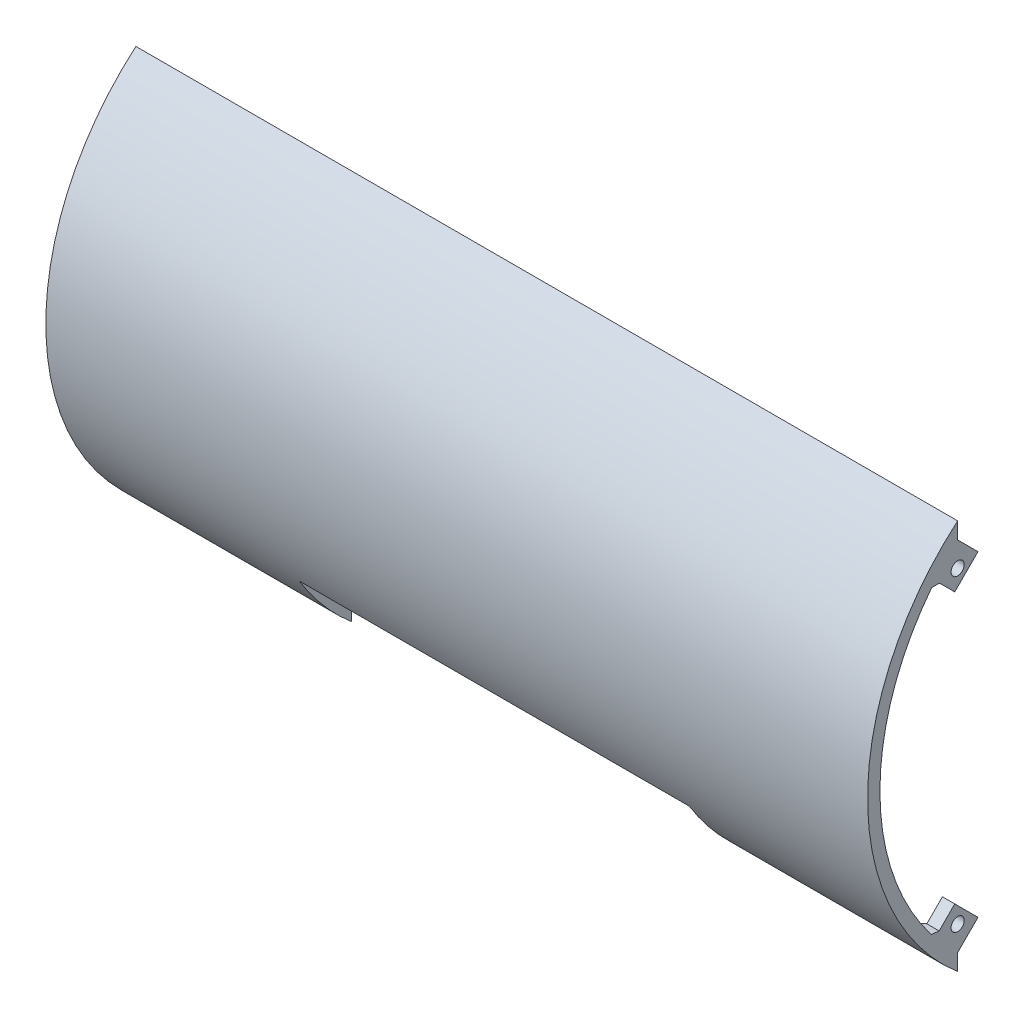
from build123d import *

# Parameters (mm, degrees)
EXTRUDE_2_DEPTH          = 200
EXTRUDE_START            = -3
SKETCH_3_R               = 1.6
EXTRUDE_3_DEPTH          = 3
MIRROR_START             = -3
MIRROR_3_COPY_1_SKETCH_R = 1.6
MIRROR_3_COPY_1_DEPTH    = 3
CHAMFER_2_SIZE           = 1.5
CHAMFER_2_SIZE_2         = 1.370885416
CUT_EXTRUDE_1_REACH      = 208.729
CUT_EXTRUDE_1_END_RADIUS = 62.42
SKETCH_4_W               = 95
SKETCH_4_H               = 15


with BuildPart() as part:
    # 草图2 → 凸台-拉伸2 (new body)
    with BuildSketch(Plane(origin=(0, 0, 0), x_dir=(0, 0, -1), z_dir=(1, 0, 0))):
        with BuildLine():
            Line((-40.496992481, 43.482525226), (-40.496992481, 47.5))
            ThreePointArc((-40.496992481, 47.5), (-62.42, 0), (-40.496992481, -47.5))
            Line((-40.496992481, -47.5), (-40.496992481, -43.482525226))
            ThreePointArc((-40.496992481, -43.482525226), (-59.42, 0), (-40.496992481, 43.482525226))
        make_face()
    extrude(amount=EXTRUDE_2_DEPTH)

    # 草图3 → 凸台-拉伸3 (add)
    with BuildSketch(Plane(origin=(200, 0, 0), x_dir=(0, 0, -1), z_dir=(1, 0, 0)).offset(EXTRUDE_START)):
        with BuildLine():
            Line((-35.547245013, 38.532777757), (-40.496992481, 43.482525226))
            ThreePointArc((-40.496992481, 43.482525226), (-43.333653576, 40.656252505), (-45.973519494, 37.64534374))
            Line((-45.973519494, 37.64534374), (-41.204099262, 32.875923508))
            Line((-41.204099262, 32.875923508), (-35.547245013, 38.532777757))
        make_face()
        with Locations((-40.496992481, 37.500401857)):
            Circle(SKETCH_3_R, mode=Mode.SUBTRACT)
    extrude_3 = extrude(amount=EXTRUDE_3_DEPTH)

    # 镜向2: 凸台-拉伸3 across plane
    add(extrude_3.mirror(Plane.ZX))

    # 镜向3: 凸台-拉伸3 across plane
    add(extrude_3.mirror(Plane(origin=(100, 0, 0), x_dir=(0, 0, 1), z_dir=(1, 0, 0))))

    # 镜向3 copy 1 sketch → 镜向3 copy 1 (add)
    with BuildSketch(Plane(origin=(0, 0, 0), x_dir=(0, 0, -1), z_dir=(-1, 0, 0)).offset(MIRROR_START)):
        with BuildLine():
            Line((-35.547245013, 38.532777757), (-40.496992481, 43.482525226))
            ThreePointArc((-40.496992481, 43.482525226), (-43.333653576, 40.656252505), (-45.973519494, 37.64534374))
            Line((-45.973519494, 37.64534374), (-41.204099262, 32.875923508))
            Line((-41.204099262, 32.875923508), (-35.547245013, 38.532777757))
        make_face()
        with Locations((-40.496992481, 37.500401857)):
            Circle(MIRROR_3_COPY_1_SKETCH_R, mode=Mode.SUBTRACT)
    extrude(amount=MIRROR_3_COPY_1_DEPTH)

    # 倒角2
    # the kernel refuses this chamfer: 1.5, 1.370885416 mm, written as the material it adds along each edge
    with BuildSketch(Plane(origin=(197, 37.64534374, 45.973519494), x_dir=(0, -0.7808949499846061, 0.6246623704758754), z_dir=(1, 0, 0)), Plane(origin=(3, -37.64534374, 45.973519494), x_dir=(0, 0.7808949499846081, 0.6246623704758728), z_dir=(-1, 0, 0))) as chamfer_2_piece_1:
        with BuildLine():
            Line((1.358262301, 0), (CHAMFER_2_SIZE * 0.110473116413, CHAMFER_2_SIZE * 0.993879112644))
            Line((CHAMFER_2_SIZE * 0.110473116413, CHAMFER_2_SIZE * 0.993879112644), (0, 0))
            ThreePointArc((0, 0), (0.697864858, -0.003878183), (1.358262301, 0))
        make_face()
    extrude(amount=3)
    with BuildSketch(Plane(origin=(197, 0, 0), x_dir=(0, 0.774455373383828, 0.6326285439631345), z_dir=(0, 0.6326285439631345, -0.774455373383828))) as chamfer_2_piece_2_section:
        Polygon((59.42, -CHAMFER_2_SIZE), (59.42 - CHAMFER_2_SIZE, 0), (59.42, 0), align=None)
    chamfer_2_piece_2 = revolve(axis=Axis((197, 0, 0), (1, 0, 0)), revolution_arc=15.163035172, mode=Mode.PRIVATE)
    chamfer_2_piece_2 = split(chamfer_2_piece_2, bisect_by=Plane(origin=(197, 0, 40.496992481), z_dir=(0, 0, -1)), keep=Keep.TOP, mode=Mode.PRIVATE)
    chamfer_2_piece_2 = split(chamfer_2_piece_2, bisect_by=Plane(origin=(197, 1.492766372, -1.492766372), z_dir=(0, -0.707106781186547, 0.707106781186548)), keep=Keep.TOP, mode=Mode.PRIVATE)
    add(chamfer_2_piece_2)
    with BuildSketch(Plane(origin=(197, 0, 0), x_dir=(0, 0.774455373383828, 0.6326285439631345), z_dir=(0, 0.6326285439631345, -0.774455373383828))) as chamfer_2_piece_3_section:
        Polygon((59.42, -CHAMFER_2_SIZE), (59.42 - CHAMFER_2_SIZE, 0), (59.42, 0), align=None)
    chamfer_2_piece_3 = revolve(axis=Axis((197, 0, 0), (1, 0, 0)), revolution_arc=15.163035172, mode=Mode.PRIVATE)
    chamfer_2_piece_3 = split(chamfer_2_piece_3, bisect_by=Plane(origin=(197, 0, 40.496992481), z_dir=(0, 0, 1)), keep=Keep.TOP, mode=Mode.PRIVATE)
    chamfer_2_piece_3 = split(chamfer_2_piece_3, bisect_by=Plane(origin=(197, -4.164087877, 4.164087877), z_dir=(0, 0.7071067811865476, -0.7071067811865476)), keep=Keep.TOP, mode=Mode.PRIVATE)
    chamfer_2_piece_3 = split(chamfer_2_piece_3, bisect_by=Plane(origin=(197, 1.492766372, -1.492766372), z_dir=(0, -0.707106781186547, 0.707106781186548)), keep=Keep.TOP, mode=Mode.PRIVATE)
    add(chamfer_2_piece_3)
    with BuildSketch(Plane(origin=(197, 0, 0), x_dir=(0, -0.774455373383828, 0.6326285439631345), z_dir=(0, -0.6326285439631345, -0.774455373383828))) as chamfer_2_piece_4_section:
        Polygon((59.42, CHAMFER_2_SIZE), (59.42 - CHAMFER_2_SIZE, 0), (59.42, 0), align=None)
    chamfer_2_piece_4 = revolve(axis=Axis((197, 0, 0), (-1, 0, 0)), revolution_arc=15.163035172, mode=Mode.PRIVATE)
    chamfer_2_piece_4 = split(chamfer_2_piece_4, bisect_by=Plane(origin=(197, 0, 40.496992481), z_dir=(0, 0, -1)), keep=Keep.TOP, mode=Mode.PRIVATE)
    chamfer_2_piece_4 = split(chamfer_2_piece_4, bisect_by=Plane(origin=(197, -1.492766372, -1.492766372), z_dir=(0, 0.707106781186547, 0.707106781186548)), keep=Keep.TOP, mode=Mode.PRIVATE)
    add(chamfer_2_piece_4)
    with BuildSketch(Plane(origin=(197, 0, 0), x_dir=(0, -0.774455373383828, 0.6326285439631345), z_dir=(0, -0.6326285439631345, -0.774455373383828))) as chamfer_2_piece_5_section:
        Polygon((59.42, CHAMFER_2_SIZE), (59.42 - CHAMFER_2_SIZE, 0), (59.42, 0), align=None)
    chamfer_2_piece_5 = revolve(axis=Axis((197, 0, 0), (-1, 0, 0)), revolution_arc=15.163035172, mode=Mode.PRIVATE)
    chamfer_2_piece_5 = split(chamfer_2_piece_5, bisect_by=Plane(origin=(197, 0, 40.496992481), z_dir=(0, 0, 1)), keep=Keep.TOP, mode=Mode.PRIVATE)
    chamfer_2_piece_5 = split(chamfer_2_piece_5, bisect_by=Plane(origin=(197, 4.164087877, 4.164087877), z_dir=(0, -0.7071067811865476, -0.7071067811865476)), keep=Keep.TOP, mode=Mode.PRIVATE)
    chamfer_2_piece_5 = split(chamfer_2_piece_5, bisect_by=Plane(origin=(197, -1.492766372, -1.492766372), z_dir=(0, 0.707106781186547, 0.707106781186548)), keep=Keep.TOP, mode=Mode.PRIVATE)
    add(chamfer_2_piece_5)
    with BuildSketch(Plane(origin=(3, 0, 0), x_dir=(0, 0.7744553733838281, 0.6326285439631345), z_dir=(0, 0.6326285439631345, -0.7744553733838281))) as chamfer_2_piece_6_section:
        Polygon((59.42, CHAMFER_2_SIZE), (59.42 - CHAMFER_2_SIZE, 0), (59.42, 0), align=None)
    chamfer_2_piece_6 = revolve(axis=Axis((3, 0, 0), (1, 0, 0)), revolution_arc=15.163035172, mode=Mode.PRIVATE)
    chamfer_2_piece_6 = split(chamfer_2_piece_6, bisect_by=Plane(origin=(3, 0, 40.496992481), z_dir=(0, 0, -1)), keep=Keep.TOP, mode=Mode.PRIVATE)
    chamfer_2_piece_6 = split(chamfer_2_piece_6, bisect_by=Plane(origin=(3, 1.492766372, -1.492766372), z_dir=(0, -0.707106781186547, 0.707106781186548)), keep=Keep.TOP, mode=Mode.PRIVATE)
    add(chamfer_2_piece_6)
    with BuildSketch(Plane(origin=(3, 0, 0), x_dir=(0, 0.7744553733838281, 0.6326285439631345), z_dir=(0, 0.6326285439631345, -0.7744553733838281))) as chamfer_2_piece_7_section:
        Polygon((59.42, CHAMFER_2_SIZE), (59.42 - CHAMFER_2_SIZE, 0), (59.42, 0), align=None)
    chamfer_2_piece_7 = revolve(axis=Axis((3, 0, 0), (1, 0, 0)), revolution_arc=15.163035172, mode=Mode.PRIVATE)
    chamfer_2_piece_7 = split(chamfer_2_piece_7, bisect_by=Plane(origin=(3, 0, 40.496992481), z_dir=(0, 0, 1)), keep=Keep.TOP, mode=Mode.PRIVATE)
    chamfer_2_piece_7 = split(chamfer_2_piece_7, bisect_by=Plane(origin=(3, -4.164087877, 4.164087877), z_dir=(0, 0.7071067811865476, -0.7071067811865476)), keep=Keep.TOP, mode=Mode.PRIVATE)
    chamfer_2_piece_7 = split(chamfer_2_piece_7, bisect_by=Plane(origin=(3, 1.492766372, -1.492766372), z_dir=(0, -0.707106781186547, 0.707106781186548)), keep=Keep.TOP, mode=Mode.PRIVATE)
    add(chamfer_2_piece_7)
    with BuildSketch(Plane(origin=(3, 0, 0), x_dir=(0, -0.7744553733838281, 0.6326285439631345), z_dir=(0, -0.6326285439631345, -0.7744553733838281))) as chamfer_2_piece_8_section:
        Polygon((59.42, -CHAMFER_2_SIZE), (59.42 - CHAMFER_2_SIZE, 0), (59.42, 0), align=None)
    chamfer_2_piece_8 = revolve(axis=Axis((3, 0, 0), (-1, 0, 0)), revolution_arc=15.163035172, mode=Mode.PRIVATE)
    chamfer_2_piece_8 = split(chamfer_2_piece_8, bisect_by=Plane(origin=(3, 0, 40.496992481), z_dir=(0, 0, -1)), keep=Keep.TOP, mode=Mode.PRIVATE)
    chamfer_2_piece_8 = split(chamfer_2_piece_8, bisect_by=Plane(origin=(3, -1.492766372, -1.492766372), z_dir=(0, 0.707106781186547, 0.707106781186548)), keep=Keep.TOP, mode=Mode.PRIVATE)
    add(chamfer_2_piece_8)
    with BuildSketch(Plane(origin=(3, 0, 0), x_dir=(0, -0.7744553733838281, 0.6326285439631345), z_dir=(0, -0.6326285439631345, -0.7744553733838281))) as chamfer_2_piece_9_section:
        Polygon((59.42, -CHAMFER_2_SIZE), (59.42 - CHAMFER_2_SIZE, 0), (59.42, 0), align=None)
    chamfer_2_piece_9 = revolve(axis=Axis((3, 0, 0), (-1, 0, 0)), revolution_arc=15.163035172, mode=Mode.PRIVATE)
    chamfer_2_piece_9 = split(chamfer_2_piece_9, bisect_by=Plane(origin=(3, 0, 40.496992481), z_dir=(0, 0, 1)), keep=Keep.TOP, mode=Mode.PRIVATE)
    chamfer_2_piece_9 = split(chamfer_2_piece_9, bisect_by=Plane(origin=(3, 4.164087877, 4.164087877), z_dir=(0, -0.7071067811865476, -0.7071067811865476)), keep=Keep.TOP, mode=Mode.PRIVATE)
    chamfer_2_piece_9 = split(chamfer_2_piece_9, bisect_by=Plane(origin=(3, -1.492766372, -1.492766372), z_dir=(0, 0.707106781186547, 0.707106781186548)), keep=Keep.TOP, mode=Mode.PRIVATE)
    add(chamfer_2_piece_9)
    with BuildSketch(Plane(origin=(197, -37.64534374, 45.973519494), x_dir=(0, 0.7815431035681409, 0.623851246103651), z_dir=(1, 0, 0)), Plane(origin=(3, 37.64534374, 45.973519494), x_dir=(0, -0.7815431035681428, 0.6238512461036486), z_dir=(-1, 0, 0))) as chamfer_2_piece_10:
        with BuildLine():
            Line((1.481642714, 0), (CHAMFER_2_SIZE_2 * 0.111504981769, -CHAMFER_2_SIZE_2 * 0.993763875055))
            Line((CHAMFER_2_SIZE_2 * 0.111504981769, -CHAMFER_2_SIZE_2 * 0.993763875055), (0, 0))
            ThreePointArc((0, 0), (0.761762493, 0.0046146), (1.481642714, 0))
        make_face()
    extrude(amount=3)
    with BuildSketch(Plane(origin=(197, 0, 0), x_dir=(0, 0.774455373383828, 0.6326285439631345), z_dir=(0, 0.6326285439631345, -0.774455373383828))) as chamfer_2_piece_11a_section:
        Polygon((59.42, -CHAMFER_2_SIZE), (59.42 - CHAMFER_2_SIZE, 0), (59.42, 0), align=None)
    chamfer_2_piece_11a = revolve(axis=Axis((197, 0, 0), (1, 0, 0)), revolution_arc=15.163035172, mode=Mode.PRIVATE)
    chamfer_2_piece_11a = split(chamfer_2_piece_11a, bisect_by=Plane(origin=(197, -4.164087877, 4.164087877), z_dir=(0, -0.7071067811865476, 0.7071067811865476)), keep=Keep.TOP, mode=Mode.PRIVATE)
    with BuildSketch(Plane(origin=(193.142475518, 37.64534374, 45.973519494), x_dir=(0, -0.7808949499846061, 0.6246623704758754), z_dir=(1, 0, 0))) as chamfer_2_piece_11b_section:
        with BuildLine():
            Line((1.358262301, 0), (CHAMFER_2_SIZE * 0.110473116413, CHAMFER_2_SIZE * 0.993879112644))
            Line((CHAMFER_2_SIZE * 0.110473116413, CHAMFER_2_SIZE * 0.993879112644), (0, 0))
            ThreePointArc((0, 0), (0.697864858, -0.003878183), (1.358262301, 0))
        make_face()
    chamfer_2_piece_11b = extrude(amount=6.857524482, mode=Mode.PRIVATE)
    chamfer_2_piece_11b = split(chamfer_2_piece_11b, bisect_by=Plane(origin=(197, 37.64534374, 45.973519494), z_dir=(-1, 0, 0)), keep=Keep.TOP, mode=Mode.PRIVATE)
    chamfer_2_piece_11 = chamfer_2_piece_11a & chamfer_2_piece_11b
    add(chamfer_2_piece_11)
    with BuildSketch(Plane(origin=(193.189644475, -37.64534374, 45.973519494), x_dir=(0, 0.7815431035681409, 0.623851246103651), z_dir=(1, 0, 0))) as chamfer_2_piece_12a_section:
        with BuildLine():
            Line((1.481642714, 0), (CHAMFER_2_SIZE_2 * 0.111504981769, -CHAMFER_2_SIZE_2 * 0.993763875055))
            Line((CHAMFER_2_SIZE_2 * 0.111504981769, -CHAMFER_2_SIZE_2 * 0.993763875055), (0, 0))
            ThreePointArc((0, 0), (0.761762493, 0.0046146), (1.481642714, 0))
        make_face()
    chamfer_2_piece_12a = extrude(amount=6.810355525, mode=Mode.PRIVATE)
    chamfer_2_piece_12a = split(chamfer_2_piece_12a, bisect_by=Plane(origin=(197, -37.64534374, 45.973519494), z_dir=(-1, 0, 0)), keep=Keep.TOP, mode=Mode.PRIVATE)
    with BuildSketch(Plane(origin=(197, 0, 0), x_dir=(0, -0.774455373383828, 0.6326285439631345), z_dir=(0, -0.6326285439631345, -0.774455373383828))) as chamfer_2_piece_12b_section:
        Polygon((59.42, CHAMFER_2_SIZE), (59.42 - CHAMFER_2_SIZE, 0), (59.42, 0), align=None)
    chamfer_2_piece_12b = revolve(axis=Axis((197, 0, 0), (-1, 0, 0)), revolution_arc=15.163035172, mode=Mode.PRIVATE)
    chamfer_2_piece_12b = split(chamfer_2_piece_12b, bisect_by=Plane(origin=(197, 4.164087877, 4.164087877), z_dir=(0, 0.7071067811865476, 0.7071067811865476)), keep=Keep.TOP, mode=Mode.PRIVATE)
    chamfer_2_piece_12 = chamfer_2_piece_12a & chamfer_2_piece_12b
    add(chamfer_2_piece_12)
    with BuildSketch(Plane(origin=(6.810355525, 37.64534374, 45.973519494), x_dir=(0, -0.7815431035681428, 0.6238512461036486), z_dir=(-1, 0, 0))) as chamfer_2_piece_13a_section:
        with BuildLine():
            Line((1.481642714, 0), (CHAMFER_2_SIZE_2 * 0.111504981769, -CHAMFER_2_SIZE_2 * 0.993763875055))
            Line((CHAMFER_2_SIZE_2 * 0.111504981769, -CHAMFER_2_SIZE_2 * 0.993763875055), (0, 0))
            ThreePointArc((0, 0), (0.761762493, 0.0046146), (1.481642714, 0))
        make_face()
    chamfer_2_piece_13a = extrude(amount=6.810355525, mode=Mode.PRIVATE)
    chamfer_2_piece_13a = split(chamfer_2_piece_13a, bisect_by=Plane(origin=(3, 37.64534374, 45.973519494), z_dir=(1, 0, 0)), keep=Keep.TOP, mode=Mode.PRIVATE)
    with BuildSketch(Plane(origin=(3, 0, 0), x_dir=(0, 0.7744553733838281, 0.6326285439631345), z_dir=(0, 0.6326285439631345, -0.7744553733838281))) as chamfer_2_piece_13b_section:
        Polygon((59.42, CHAMFER_2_SIZE), (59.42 - CHAMFER_2_SIZE, 0), (59.42, 0), align=None)
    chamfer_2_piece_13b = revolve(axis=Axis((3, 0, 0), (1, 0, 0)), revolution_arc=15.163035172, mode=Mode.PRIVATE)
    chamfer_2_piece_13b = split(chamfer_2_piece_13b, bisect_by=Plane(origin=(3, -4.164087877, 4.164087877), z_dir=(0, -0.7071067811865476, 0.7071067811865476)), keep=Keep.TOP, mode=Mode.PRIVATE)
    chamfer_2_piece_13 = chamfer_2_piece_13a & chamfer_2_piece_13b
    add(chamfer_2_piece_13)
    with BuildSketch(Plane(origin=(3, 0, 0), x_dir=(0, -0.7744553733838281, 0.6326285439631345), z_dir=(0, -0.6326285439631345, -0.7744553733838281))) as chamfer_2_piece_14a_section:
        Polygon((59.42, -CHAMFER_2_SIZE), (59.42 - CHAMFER_2_SIZE, 0), (59.42, 0), align=None)
    chamfer_2_piece_14a = revolve(axis=Axis((3, 0, 0), (-1, 0, 0)), revolution_arc=15.163035172, mode=Mode.PRIVATE)
    chamfer_2_piece_14a = split(chamfer_2_piece_14a, bisect_by=Plane(origin=(3, 4.164087877, 4.164087877), z_dir=(0, 0.7071067811865476, 0.7071067811865476)), keep=Keep.TOP, mode=Mode.PRIVATE)
    with BuildSketch(Plane(origin=(6.857524482, -37.64534374, 45.973519494), x_dir=(0, 0.7808949499846081, 0.6246623704758728), z_dir=(-1, 0, 0))) as chamfer_2_piece_14b_section:
        with BuildLine():
            Line((1.358262301, 0), (CHAMFER_2_SIZE * 0.110473116413, CHAMFER_2_SIZE * 0.993879112644))
            Line((CHAMFER_2_SIZE * 0.110473116413, CHAMFER_2_SIZE * 0.993879112644), (0, 0))
            ThreePointArc((0, 0), (0.697864858, -0.003878183), (1.358262301, 0))
        make_face()
    chamfer_2_piece_14b = extrude(amount=6.857524482, mode=Mode.PRIVATE)
    chamfer_2_piece_14b = split(chamfer_2_piece_14b, bisect_by=Plane(origin=(3, -37.64534374, 45.973519494), z_dir=(1, 0, 0)), keep=Keep.TOP, mode=Mode.PRIVATE)
    chamfer_2_piece_14 = chamfer_2_piece_14a & chamfer_2_piece_14b
    add(chamfer_2_piece_14)

    # 切除-拉伸1: up to this cylinder (the profile starts inside it)
    cut_extrude_1_end = Plane(origin=(100, 0, 0), z_dir=(-1, 0, 0)) * Cylinder(CUT_EXTRUDE_1_END_RADIUS, 543.298, mode=Mode.PRIVATE)
    # 草图4 → 切除-拉伸1 (cut, up to the surface)
    with BuildSketch(Plane(origin=(0, 0, 40.496992481), x_dir=(-1, 0, 0), z_dir=(0, 0, -1)), mode=Mode.PRIVATE) as cut_extrude_1_sk1:
        with Locations((-100, -40)):
            Rectangle(SKETCH_4_W, SKETCH_4_H)
    cut_extrude_1_tool1 = extrude(cut_extrude_1_sk1.sketch, amount=-CUT_EXTRUDE_1_REACH, mode=Mode.PRIVATE) & cut_extrude_1_end
    add(cut_extrude_1_tool1.solids().sort_by_distance((100, -40, 40.496992))[0], mode=Mode.SUBTRACT)


solid = part.part
